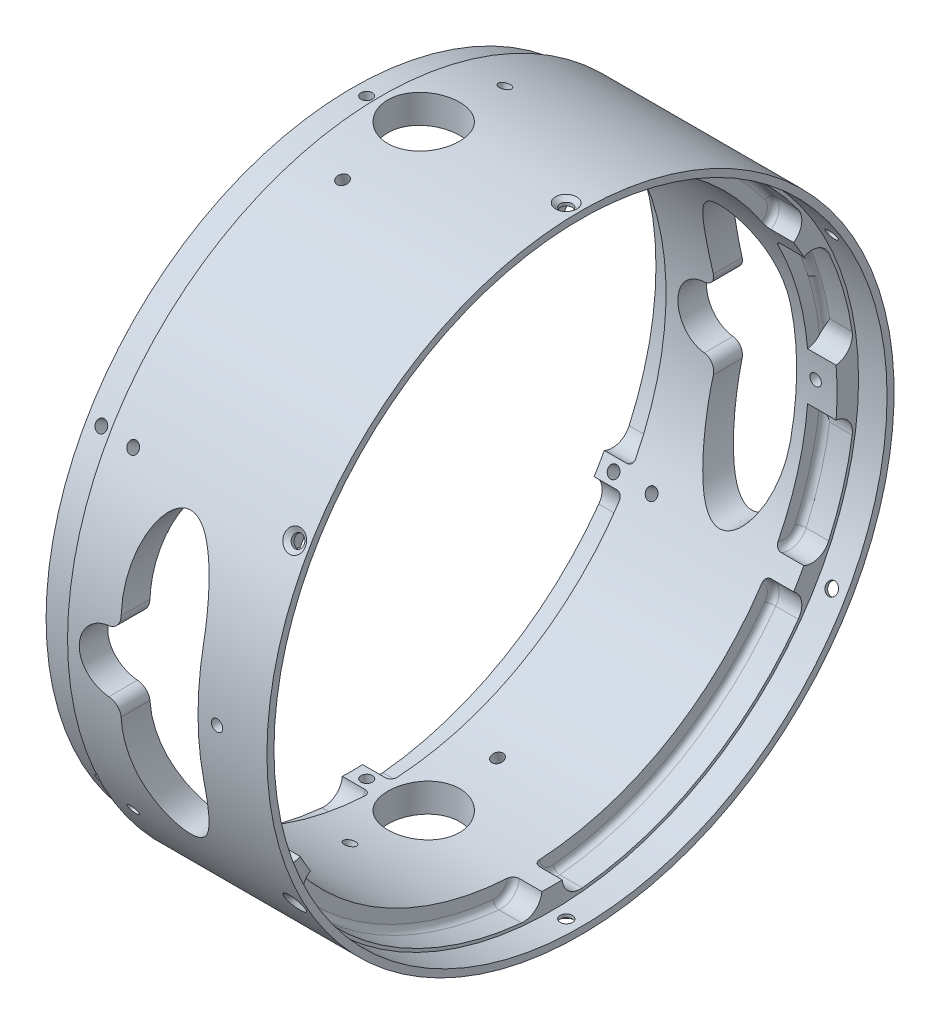
from build123d import *
from build123d.topology import SkipClean

# Parameters (mm, degrees)
F_31_0_12_DIAMETER_HOLE1_REACH                    = 196.298
F_31_0_12_DIAMETER_HOLE1_BORE_R                   = 1.524
CIRPATTERN4_COUNT                                 = 6
CUT_EXTRUDE1_DEPTH                                = 7.62
CUT_EXTRUDE2_START                                = -7.62
CUT_EXTRUDE2_DEPTH                                = 7.62
FILLET1_R                                         = 1.5875
CIRPATTERN6_COUNT                                 = 6
FILLET1_OF_CIRPATTERN6_R                          = 1.5875
CSK_FOR_4_FLAT_HEAD_MACHINE_SCREW_100_D           = 3.2639
CSK_FOR_4_FLAT_HEAD_MACHINE_SCREW_100_CSINK_D     = 5.715
CSK_FOR_4_FLAT_HEAD_MACHINE_SCREW_100_CSINK_ANGLE = 100
CIRPATTERN5_COUNT                                 = 6
CUT_EXTRUDE5_DEPTH                                = 148.905795136
CUT_EXTRUDE5_DEPTH_BACK                           = 148.905795136
CUT_EXTRUDE13_DEPTH                               = 130.987462642
CUT_EXTRUDE13_DEPTH_BACK                          = 130.987462642
SKETCH23_R                                        = 9.5885
BOSS_EXTRUDE1_REACH                               = 190.354
F_31_START                                        = -158
F_31_0_12_DIAMETER_HOLE2_OUTLINE_R                = 1.524
F_31_0_12_DIAMETER_HOLE2_DEPTH                    = 9
F_31_0_12_DIAMETER_HOLE2_2_OUTLINE_R              = 1.524
F_31_0_12_DIAMETER_HOLE2_2_DEPTH                  = 9
F_31_START_2                                      = -123
F_31_0_12_DIAMETER_HOLE2_3_OUTLINE_R              = 1.524
F_31_0_12_DIAMETER_HOLE2_3_DEPTH                  = 10
F_31_START_3                                      = 37
F_31_0_12_DIAMETER_HOLE2_4_OUTLINE_R              = 1.524
F_31_0_12_DIAMETER_HOLE2_4_DEPTH                  = 10
F_31_START_4                                      = 75
F_31_0_12_DIAMETER_HOLE2_5_OUTLINE_R              = 1.524
F_31_0_12_DIAMETER_HOLE2_5_DEPTH                  = 10
CIRPATTERN7_COUNT                                 = 2


with BuildPart() as part:
    # Sketch1 → Revolve2 (revolve)
    with BuildSketch(Plane.XY, mode=Mode.PRIVATE) as revolve2_sk:
        Polygon((-0.762, 7.62), (7.62, 7.62), (7.62, 5.7404), (0, 5.7404), (0, 0), (-53.34, 0), (-53.34, 5.6896), (-45.6692, 5.6896), (-45.6692, 7.62), align=None)
    revolve(revolve2_sk.sketch.rotate(Axis((-51.956158524, -76.2, 0), (1, 0, 0)), 90), axis=Axis((-51.956158524, -76.2, 0), (1, 0, 0)))

    # #31 (0.12) Diameter Hole1 bore (on position points) → #31 (0.12) Diameter Hole1 (cut, up to next)
    with BuildSketch(Plane(origin=(-49.53, -158.0896, 0), x_dir=(0, 0, -1), z_dir=(0, -1, 0)), mode=Mode.PRIVATE) as f_31_0_12_diameter_hole1_sk1:
        Circle(F_31_0_12_DIAMETER_HOLE1_BORE_R)
    f_31_0_12_diameter_hole1_tool1 = extrude(f_31_0_12_diameter_hole1_sk1.sketch, amount=-F_31_0_12_DIAMETER_HOLE1_REACH, mode=Mode.PRIVATE) & part.part
    f_31_0_12_diameter_hole1 = f_31_0_12_diameter_hole1_tool1.solids().sort_by_distance((-49.53, -158.0896, 0))[0]
    add(f_31_0_12_diameter_hole1, mode=Mode.SUBTRACT)

    # CirPattern4: #31 (0.12) Diameter Hole1 ×6 about axis
    cirpattern4_axis = Axis((0, -76.2, 0), (1, 0, 0))
    for i in range(1, CIRPATTERN4_COUNT):
        add(f_31_0_12_diameter_hole1.rotate(cirpattern4_axis, i * 360 / CIRPATTERN4_COUNT), mode=Mode.SUBTRACT)

    # Sketch8 → Cut-Extrude1 (cut)
    with BuildSketch(Plane.ZY.offset(53.34)):
        with BuildLine():
            ThreePointArc((-64.590076174, -116.629717533), (-66.692018058, -119.849215758), (-65.841049379, -123.598773174))
            ThreePointArc((-65.841049379, -123.598773174), (-40.5638, -146.458562548), (-8.128016987, -156.919407961))
            ThreePointArc((-8.128016987, -156.919407961), (-4.455320673, -155.781589747), (-2.718124364, -152.351505566))
            ThreePointArc((-2.718124364, -152.351505566), (-38.1, -142.191135768), (-64.590076174, -116.629717533))
        make_face()
    cut_extrude1 = extrude(amount=-CUT_EXTRUDE1_DEPTH, mode=Mode.SUBTRACT)

    # Sketch13 → Cut-Extrude2 (cut)
    with BuildSketch(Plane(origin=(0, 0, 0), x_dir=(0, 0, -1), z_dir=(1, 0, 0)).offset(CUT_EXTRUDE2_START)):
        with BuildLine():
            ThreePointArc((64.590076174, -116.629717533), (38.1, -142.191135768), (2.718124364, -152.351505566))
            ThreePointArc((2.718124364, -152.351505566), (4.455320673, -155.781589747), (8.128016987, -156.919407961))
            ThreePointArc((8.128016987, -156.919407961), (40.5638, -146.458562548), (65.841049379, -123.598773174))
            ThreePointArc((65.841049379, -123.598773174), (66.692018058, -119.849215758), (64.590076174, -116.629717533))
        make_face()
    cut_extrude2 = extrude(amount=CUT_EXTRUDE2_DEPTH, mode=Mode.SUBTRACT)

    # Fillet1
    fillet1_edges = [part.edges().sort_by_distance(p)[0] for p in [
        (-45.72, -146.458562548, -40.5638),
        (-45.72, -119.849215758, -66.692018058),
        (-45.72, -155.781589747, -4.455320673),
        (-7.62, -155.781589747, -4.455320673),
        (-7.62, -119.849215758, -66.692018058),
        (-7.62, -146.458562548, -40.5638),
    ]]
    fillet(fillet1_edges, radius=FILLET1_R)

    # CirPattern6: Cut-Extrude1, Cut-Extrude2 ×6 about axis
    cirpattern6_axis = Axis((0, -76.2, 0), (1, 0, 0))
    add([cut_extrude1.rotate(cirpattern6_axis, i * 360 / CIRPATTERN6_COUNT) for i in range(1, CIRPATTERN6_COUNT)], mode=Mode.SUBTRACT)
    add([cut_extrude2.rotate(cirpattern6_axis, i * 360 / CIRPATTERN6_COUNT) for i in range(1, CIRPATTERN6_COUNT)], mode=Mode.SUBTRACT)

    # Fillet1 of CirPattern6
    fillet1_of_cirpattern6_edges = [part.edges().sort_by_distance(p)[0] for p in [
        (-45.72, -76.2, -81.1276),
        (-45.72, -40.267626011, -71.147338731),
        (-45.72, -112.132373989, -71.147338731),
        (-7.62, -112.132373989, -71.147338731),
        (-7.62, -40.267626011, -71.147338731),
        (-7.62, -76.2, -81.1276),
        (-45.72, -5.941437452, -40.5638),
        (-45.72, 3.381589747, -4.455320673),
        (-45.72, -32.550784242, -66.692018058),
        (-7.62, -32.550784242, -66.692018058),
        (-7.62, 3.381589747, -4.455320673),
        (-7.62, -5.941437452, -40.5638),
        (-45.72, -5.941437452, 40.5638),
        (-45.72, -32.550784242, 66.692018058),
        (-45.72, 3.381589747, 4.455320673),
        (-7.62, 3.381589747, 4.455320673),
        (-7.62, -32.550784242, 66.692018058),
        (-7.62, -5.941437452, 40.5638),
        (-45.72, -76.2, 81.1276),
        (-45.72, -112.132373989, 71.147338731),
        (-45.72, -40.267626011, 71.147338731),
        (-7.62, -40.267626011, 71.147338731),
        (-7.62, -112.132373989, 71.147338731),
        (-7.62, -76.2, 81.1276),
        (-45.72, -146.458562548, 40.5638),
        (-45.72, -155.781589747, 4.455320673),
        (-45.72, -119.849215758, 66.692018058),
        (-7.62, -119.849215758, 66.692018058),
        (-7.62, -155.781589747, 4.455320673),
        (-7.62, -146.458562548, 40.5638),
    ]]
    fillet(fillet1_of_cirpattern6_edges, radius=FILLET1_OF_CIRPATTERN6_R)

    # CSK for #4 Flat Head Machine Screw (100)1 (through all)
    with Locations(Plane(origin=(3.81, -160.02, 0), x_dir=(0, 0, -1), z_dir=(0, -1, 0))):
        with Locations((0, 0)):
            csk_for_4_flat_head_machine_screw_100 = CounterSinkHole(CSK_FOR_4_FLAT_HEAD_MACHINE_SCREW_100_D / 2, CSK_FOR_4_FLAT_HEAD_MACHINE_SCREW_100_CSINK_D / 2, counter_sink_angle=CSK_FOR_4_FLAT_HEAD_MACHINE_SCREW_100_CSINK_ANGLE)

    # CirPattern5: CSK for #4 Flat Head Machine Screw (100)1 ×6 about axis
    cirpattern5_axis = Axis((7.62, -76.2, 0), (-1, 0, 0))
    for i in range(1, CIRPATTERN5_COUNT):
        add(csk_for_4_flat_head_machine_screw_100.rotate(cirpattern5_axis, i * 360 / CIRPATTERN5_COUNT), mode=Mode.SUBTRACT)

    # Sketch22 → Cut-Extrude5 (cut, two sides: drawn at the far end of the back side and taken through both)
    with BuildSketch(Plane(origin=(12.465755717, -76.935542211, -18.141203309), x_dir=(1, 0, 0), z_dir=(0, 0, 1)).offset(-CUT_EXTRUDE5_DEPTH_BACK)):
        with BuildLine():
            ThreePointArc((-44.645862848, -10.958742352), (-45.356953283, -8.624882812), (-47.513859586, -7.484573575))
            ThreePointArc((-47.513859586, -7.484573575), (-55.010755717, 0.735542211), (-47.513859586, 8.955657996))
            ThreePointArc((-47.513859586, 8.955657996), (-45.356953283, 10.095967233), (-44.645862848, 12.429826773))
            add(Edge.make_bspline(
                [(-23.260755717, 16.62042399), (-23.260755717, 40.42922599), (-35.108647383, 38.10752886), (-46.956539048, 35.785831731), (-44.645862848, 12.429826773)],
                knots=[4.71238898, 4.71238898, 4.71238898, 6.380854752, 6.380854752, 8.049320524, 8.049320524, 8.049320524], degree=2, weights=[1, 0.671746144, 1, 0.671746144, 1]))
            Line((-23.260755717, 16.62042399), (-23.260755717, -15.149339569))
            add(Edge.make_bspline(
                [(-44.645862848, -10.958742352), (-46.956539048, -34.31474731), (-35.108647383, -36.636444439), (-23.260755717, -38.958141569), (-23.260755717, -15.149339569)],
                knots=[4.51705009, 4.51705009, 4.51705009, 6.185515862, 6.185515862, 7.853981634, 7.853981634, 7.853981634], degree=2, weights=[1, 0.671746144, 1, 0.671746144, 1]))
        make_face()
    extrude(amount=CUT_EXTRUDE5_DEPTH + CUT_EXTRUDE5_DEPTH_BACK, mode=Mode.SUBTRACT)

    # Sketch23 → Cut-Extrude13 (cut, two sides: drawn at the far end of the back side and taken through both)
    with BuildSketch(Plane(origin=(0, -76.2, 0), x_dir=(1, 0, 0), z_dir=(0, 1, 0)).offset(-CUT_EXTRUDE13_DEPTH_BACK)):
        with Locations(Location((-34.29, 0, 0), (0, 0, 270))):
            Circle(SKETCH23_R)
    extrude(amount=CUT_EXTRUDE13_DEPTH + CUT_EXTRUDE13_DEPTH_BACK, mode=Mode.SUBTRACT)

    # Sketch25 → Boss-Extrude1 (add, up to next)
    with BuildSketch(Plane(origin=(0, 0, 0), x_dir=(0, 0, -1), z_dir=(1, 0, 0)), mode=Mode.PRIVATE) as boss_extrude1_sk1:
        with BuildLine():
            ThreePointArc((-75.934955719, -69.85), (-76.2, -76.2), (-75.934955719, -82.55))
            ThreePointArc((-75.934955719, -82.55), (-79.278207608, -84.448945843), (-80.239418371, -88.171767672))
            ThreePointArc((-80.239418371, -88.171767672), (-81.1276, -76.2), (-80.239418371, -64.228232328))
            ThreePointArc((-80.239418371, -64.228232328), (-79.278207608, -67.951054157), (-75.934955719, -69.85))
        make_face()
    boss_extrude1_tool1 = extrude(boss_extrude1_sk1.sketch, amount=-BOSS_EXTRUDE1_REACH, mode=Mode.PRIVATE) - part.part
    # Sketch25 → Boss-Extrude1 (add, up to next)
    with BuildSketch(Plane(origin=(0, 0, 0), x_dir=(0, 0, -1), z_dir=(1, 0, 0)), mode=Mode.PRIVATE) as boss_extrude1_sk2:
        with BuildLine():
            ThreePointArc((75.934955719, -69.85), (79.278207608, -67.951054157), (80.239418371, -64.228232328))
            ThreePointArc((80.239418371, -64.228232328), (81.1276, -76.2), (80.239418371, -88.171767672))
            ThreePointArc((80.239418371, -88.171767672), (79.278207608, -84.448945843), (75.934955719, -82.55))
            ThreePointArc((75.934955719, -82.55), (76.2, -76.2), (75.934955719, -69.85))
        make_face()
    boss_extrude1_tool2 = extrude(boss_extrude1_sk2.sketch, amount=-BOSS_EXTRUDE1_REACH, mode=Mode.PRIVATE) - part.part
    add(boss_extrude1_tool1.solids().sort_by_distance((0, -76.2, 78.749805))[0])
    add(boss_extrude1_tool2.solids().sort_by_distance((0, -76.2, -78.749805))[0])

    # #31 (0.12) Diameter Hole2: read off the stored shape, not the designer's step
    # #31 (0.12) Diameter Hole2 outline → #31 (0.12) Diameter Hole2 (cut)
    with SkipClean():  # the faces are left unmerged after this step: merging them gives an invalid solid
        with BuildSketch(Plane(origin=(0, 0, 0), x_dir=(1, 0, 0), z_dir=(0, 0.9659258262890701, -0.2588190451025141)).offset(F_31_START)):
            with Locations((-34.29, 19.722011237)):
                Circle(F_31_0_12_DIAMETER_HOLE2_OUTLINE_R)
        f_31_0_12_diameter_hole2 = extrude(amount=F_31_0_12_DIAMETER_HOLE2_DEPTH, mode=Mode.SUBTRACT)

    # 31 _0.12_ Diameter Hole2 2 outline → 31 _0.12_ Diameter Hole2 2 (cut)
    with SkipClean():  # the faces are left unmerged after this step: merging them gives an invalid solid
        with BuildSketch(Plane(origin=(0, 0, 0), x_dir=(1, 0, 0), z_dir=(0, 0.9659258262890699, 0.258819045102515)).offset(F_31_START)):
            with Locations((-34.29, -19.722011237)):
                Circle(F_31_0_12_DIAMETER_HOLE2_2_OUTLINE_R)
        f_31_0_12_diameter_hole2_2 = extrude(amount=F_31_0_12_DIAMETER_HOLE2_2_DEPTH, mode=Mode.SUBTRACT)

    # 31 _0.12_ Diameter Hole2 3 outline → 31 _0.12_ Diameter Hole2 3 (cut)
    with SkipClean():  # the faces are left unmerged after this step: merging them gives an invalid solid
        with BuildSketch(Plane(origin=(0, 0, 0), x_dir=(1, 0, 0), z_dir=(0, 0.49996809917136686, -0.8660438209530568)).offset(F_31_START_2)):
            with Locations((-39.37, 65.992539157)):
                Circle(F_31_0_12_DIAMETER_HOLE2_3_OUTLINE_R)
        f_31_0_12_diameter_hole2_3 = extrude(amount=F_31_0_12_DIAMETER_HOLE2_3_DEPTH, mode=Mode.SUBTRACT)

    # 31 _0.12_ Diameter Hole2 4 outline → 31 _0.12_ Diameter Hole2 4 (cut)
    with SkipClean():  # the faces are left unmerged after this step: merging them gives an invalid solid
        with BuildSketch(Plane(origin=(0, 0, 0), x_dir=(1, 0, 0), z_dir=(0, 0.49996809917136686, 0.8660438209530568)).offset(F_31_START_3)):
            with Locations((-39.37, -65.992539157)):
                Circle(F_31_0_12_DIAMETER_HOLE2_4_OUTLINE_R)
        f_31_0_12_diameter_hole2_4 = extrude(amount=F_31_0_12_DIAMETER_HOLE2_4_DEPTH, mode=Mode.SUBTRACT)

    # 31 _0.12_ Diameter Hole2 5 outline → 31 _0.12_ Diameter Hole2 5 (cut)
    with SkipClean():  # the faces are left unmerged after this step: merging them gives an invalid solid
        with BuildSketch(Plane.XY.offset(F_31_START_4)):
            with Locations((-5.715, -76.2)):
                Circle(F_31_0_12_DIAMETER_HOLE2_5_OUTLINE_R)
        f_31_0_12_diameter_hole2_5 = extrude(amount=F_31_0_12_DIAMETER_HOLE2_5_DEPTH, mode=Mode.SUBTRACT)

    # CirPattern7: #31 (0.12) Diameter Hole2, 31 _0.12_ Diameter Hole2 2, 31 _0.12_ Diameter Hole2 3, 31 _0.12_ Diameter Hole2 4, 31 _0.12_ Diameter Hole2 5 ×2 about axis
    with SkipClean():  # the faces are left unmerged after this step: merging them gives an invalid solid
        cirpattern7_axis = Axis((7.62, -76.2, 0), (-1, 0, 0))
        add([f_31_0_12_diameter_hole2.rotate(cirpattern7_axis, i * 360 / CIRPATTERN7_COUNT) for i in range(1, CIRPATTERN7_COUNT)], mode=Mode.SUBTRACT)
        add([f_31_0_12_diameter_hole2_2.rotate(cirpattern7_axis, i * 360 / CIRPATTERN7_COUNT) for i in range(1, CIRPATTERN7_COUNT)], mode=Mode.SUBTRACT)
        add([f_31_0_12_diameter_hole2_3.rotate(cirpattern7_axis, i * 360 / CIRPATTERN7_COUNT) for i in range(1, CIRPATTERN7_COUNT)], mode=Mode.SUBTRACT)
        add([f_31_0_12_diameter_hole2_4.rotate(cirpattern7_axis, i * 360 / CIRPATTERN7_COUNT) for i in range(1, CIRPATTERN7_COUNT)], mode=Mode.SUBTRACT)
        add([f_31_0_12_diameter_hole2_5.rotate(cirpattern7_axis, i * 360 / CIRPATTERN7_COUNT) for i in range(1, CIRPATTERN7_COUNT)], mode=Mode.SUBTRACT)


solid = part.part
